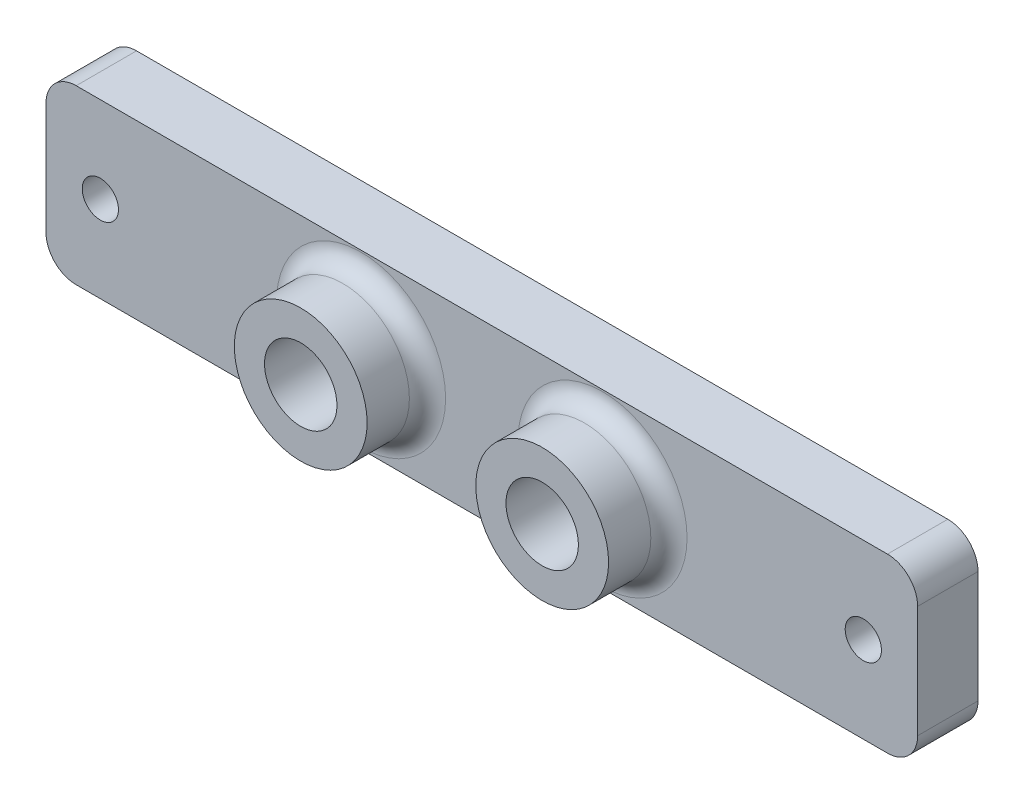
from build123d import *

# Parameters (mm, degrees)
SKETCH_1_W          = 72.2
SKETCH_1_H          = 14.28
SKETCH_1_R          = 1.5
SKETCH_1_R_2        = 3
EXTRUDE_1_DEPTH     = 5
FILLET_1_R          = 2.5
SKETCH_2_R          = 5.5
SKETCH_2_R_2        = 3
EXTRUDE_2_DEPTH     = 5
FILLET_2_R          = 1.5
SKETCH_4_R          = 2.5
CUT_EXTRUDE_1_DEPTH = 2


with BuildPart() as part:
    # 草图1 → 凸台-拉伸1 (new body)
    with BuildSketch(Plane.XY):
        Rectangle(SKETCH_1_W, SKETCH_1_H)
        with Locations((-31.6, 0)):
            Circle(SKETCH_1_R, mode=Mode.SUBTRACT)
        with Locations((-10, 0)):
            Circle(SKETCH_1_R_2, mode=Mode.SUBTRACT)
        with Locations((10, 0)):
            Circle(SKETCH_1_R_2, mode=Mode.SUBTRACT)
        with Locations((31.6, 0)):
            Circle(SKETCH_1_R, mode=Mode.SUBTRACT)
    extrude(amount=EXTRUDE_1_DEPTH)

    # 圆角1
    fillet_1_edges = [part.edges().sort_by_distance(p)[0] for p in [
        (36.1, -7.14, 2.5),
        (-36.1, -7.14, 2.5),
        (-36.1, 7.14, 2.5),
        (36.1, 7.14, 2.5),
    ]]
    fillet(fillet_1_edges, radius=FILLET_1_R)

    # 草图2 → 凸台-拉伸2 (add)
    # profile 1 of 2: a face of its own
    with BuildSketch(Plane.XY.offset(5)):
        with Locations((-10, 0)):
            Circle(SKETCH_2_R)
        with Locations((-10, 0)):
            Circle(SKETCH_2_R_2, mode=Mode.SUBTRACT)
    # profile 2 of 2: a face of its own
    with BuildSketch(Plane.XY.offset(5)):
        with Locations((10, 0)):
            Circle(SKETCH_2_R)
        with Locations((10, 0)):
            Circle(SKETCH_2_R_2, mode=Mode.SUBTRACT)
    extrude(amount=EXTRUDE_2_DEPTH)

    # 圆角2
    fillet_2_edges = [part.edges().sort_by_distance(p)[0] for p in [
        (4.5, 0, 5),
        (-15.5, 0, 5),
    ]]
    fillet(fillet_2_edges, radius=FILLET_2_R)

    # 草图4 → 切除-拉伸1 (cut)
    with BuildSketch(Plane(origin=(0, 0, 0), x_dir=(-1, 0, 0), z_dir=(0, 0, -1))):
        with Locations((-4.5, 0.86)):
            Circle(SKETCH_4_R)
        with Locations((4.5, 0.86)):
            Circle(SKETCH_4_R)
    extrude(amount=-CUT_EXTRUDE_1_DEPTH, mode=Mode.SUBTRACT)


solid = part.part
